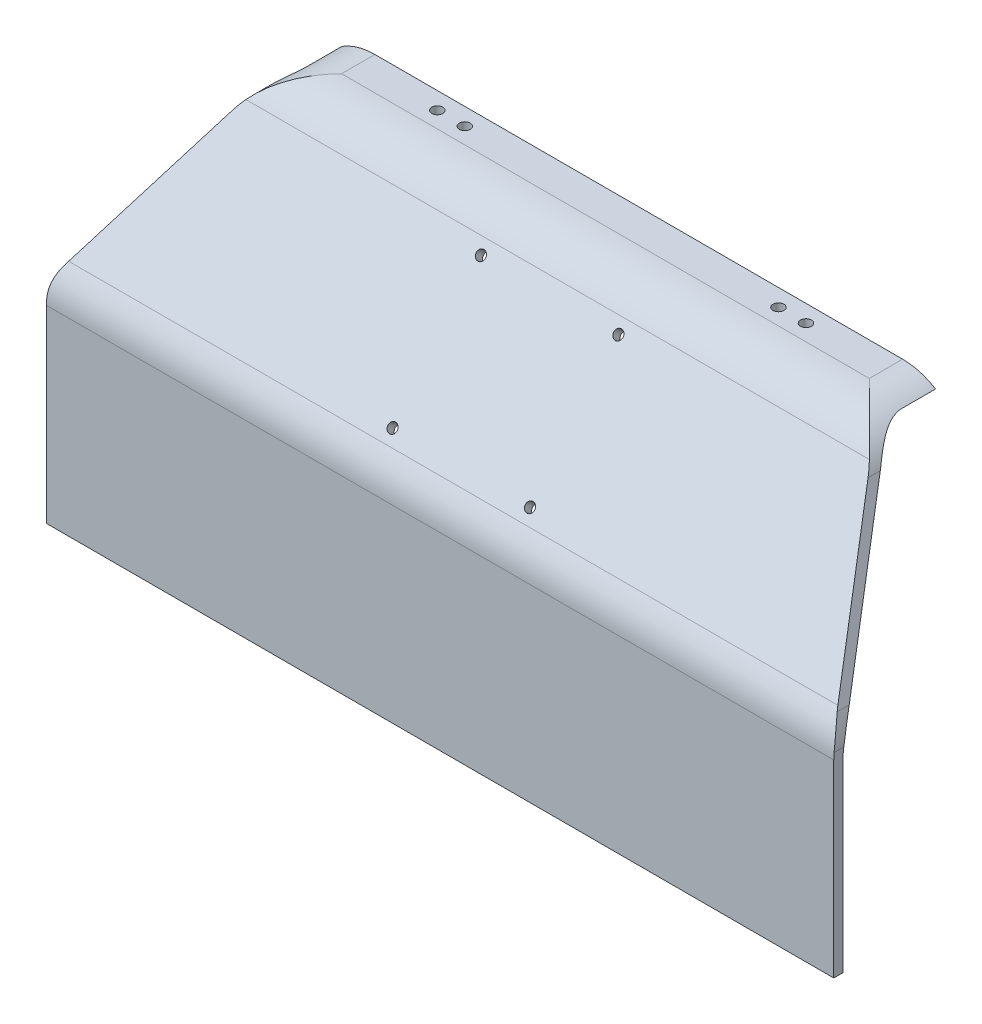
from build123d import *

# Parameters (mm, degrees)
SALIENTE_EXTRUIR1_DEPTH = 126
REDONDEO1_R             = 18
REDONDEO2_R             = 20
REDONDEO3_R             = 17
REDONDEO4_R             = 17
CORTAR_EXTRUIR1_DEPTH   = 186.234557368
REDONDEO5_R             = 17
CORTAR_EXTRUIR2_DEPTH   = 186.23455747
CROQUIS6_R              = 1.75
CORTAR_EXTRUIR3_DEPTH   = 20
CROQUIS7_W              = 252
CROQUIS7_H              = 3
CORTAR_EXTRUIR4_DEPTH   = 1
CROQUIS9_R              = 1.5
CORTAR_EXTRUIR5_DEPTH   = 183.297245602


with BuildPart() as part:
    # Croquis1 → Saliente-Extruir1 (new, symmetric)
    with BuildSketch(Plane(origin=(0, 0, 0), x_dir=(0, 0, -1), z_dir=(1, 0, 0))):
        Polygon((0, 0), (0, 66.908089297), (41.999818789, 116.961524227), (60.600895814, 116.961524227), (60.600895814, 119.961524227), (40.600895814, 119.961524227), (-3, 68), (-3, 0), align=None)
    extrude(amount=SALIENTE_EXTRUIR1_DEPTH, both=True)

    # Redondeo1
    redondeo1_edges = [part.edges().sort_by_distance(p)[0] for p in [
        (0, 68, 3),
    ]]
    fillet(redondeo1_edges, radius=REDONDEO1_R)

    # Redondeo2
    redondeo2_edges = [part.edges().sort_by_distance(p)[0] for p in [
        (0, 119.961524227, -40.600895814),
    ]]
    fillet(redondeo2_edges, radius=REDONDEO2_R)

    # Redondeo3
    redondeo3_edges = [part.edges().sort_by_distance(p)[0] for p in [
        (0, 116.961524227, -41.999818789),
    ]]
    fillet(redondeo3_edges, radius=REDONDEO3_R)

    # Redondeo4
    redondeo4_edges = [part.edges().sort_by_distance(p)[0] for p in [
        (0, 66.908089297, 0),
    ]]
    fillet(redondeo4_edges, radius=REDONDEO4_R)

    # Croquis2 → Cortar-Extruir1 (cut, through all)
    with BuildSketch(Plane.XY.offset(3)):
        Polygon((-96, 119.961524227), (-126, 68), (-126, 119.961524227), align=None)
    cortar_extruir1 = extrude(amount=-CORTAR_EXTRUIR1_DEPTH, mode=Mode.SUBTRACT)

    # Simetría1: Cortar-Extruir1 across plane
    add(cortar_extruir1.mirror(Plane(origin=(0, 0, 0), x_dir=(0, 0, 1), z_dir=(1, 0, 0))), mode=Mode.SUBTRACT)

    # Redondeo5
    # the kernel refuses this fillet: 17 mm, written as the material it takes off along each edge
    with BuildSketch(Plane(origin=(-126, 68, 13.153231119), x_dir=(0, -1, 0), z_dir=(0, 0, -1)), Plane(origin=(126, 68, 13.153231119), x_dir=(-0.49999999999999856, 0.8660254037844395, 0), z_dir=(0, 0, -1))) as redondeo5_piece_1:
        with BuildLine():
            CenterArc((REDONDEO5_R * 0.267949192431, -REDONDEO5_R), REDONDEO5_R, 90, 30)
            Line((-REDONDEO5_R * 0.232050807569, -REDONDEO5_R * 0.133974596216), (0, 0))
            Line((0, 0), (REDONDEO5_R * 0.267949192431, 0))
        make_face()
    extrude(amount=26.178446129, mode=Mode.SUBTRACT)

    # Croquis5 → Cortar-Extruir2 (cut, through all)
    with BuildSketch(Plane(origin=(0, 0, -60.600895814), x_dir=(-1, 0, 0), z_dir=(0, 0, -1))):
        with BuildLine():
            Line((84.452994616, 119.961524227), (96, 119.961524227))
            Line((96, 119.961524227), (101.773502692, 109.961524227))
            ThreePointArc((101.773502692, 109.961524227), (94.452994616, 117.282032303), (84.452994616, 119.961524227))
        make_face()
    cortar_extruir2 = extrude(amount=-CORTAR_EXTRUIR2_DEPTH, mode=Mode.SUBTRACT)

    # Simetría2: Cortar-Extruir2 across plane
    add(cortar_extruir2.mirror(Plane(origin=(0, 0, 0), x_dir=(0, 0, 1), z_dir=(1, 0, 0))), mode=Mode.SUBTRACT)

    # Croquis6 → Cortar-Extruir3 (cut)
    with BuildSketch(Plane(origin=(0, 119.961524227, 0), x_dir=(1, 0, 0), z_dir=(0, 1, 0))):
        with Locations(Location((-59, 55.100895814, 0), (0, 0, 270))):
            Circle(CROQUIS6_R)
        with Locations(Location((-50.2, 55.100895814, 0), (0, 0, 270))):
            Circle(CROQUIS6_R)
    cortar_extruir3 = extrude(amount=-CORTAR_EXTRUIR3_DEPTH, mode=Mode.SUBTRACT)

    # Simetría3: Cortar-Extruir3 across plane
    add(cortar_extruir3.mirror(Plane(origin=(0, 0, 0), x_dir=(0, 0, 1), z_dir=(1, 0, 0))), mode=Mode.SUBTRACT)

    # Croquis7 → Cortar-Extruir4 (cut)
    with BuildSketch(Plane.XZ):
        with Locations((0, 1.5)):
            Rectangle(CROQUIS7_W, CROQUIS7_H)
    extrude(amount=-CORTAR_EXTRUIR4_DEPTH, mode=Mode.SUBTRACT)

    # Croquis9 → Cortar-Extruir5 (cut, through all)
    with BuildSketch(Plane(origin=(0, 29.573173589, 35.243935869), x_dir=(1, 0, 0), z_dir=(0, 0.6427876096865381, 0.7660444431189791))):
        with Locations(Location((-22, 104.71412352, 0), (0, 0, 270))):
            Circle(CROQUIS9_R)
        with Locations(Location((22, 104.71412352, 0), (0, 0, 270))):
            Circle(CROQUIS9_R)
        with Locations(Location((22, 60.71412352, 0), (0, 0, 270))):
            Circle(CROQUIS9_R)
        with Locations(Location((-22, 60.71412352, 0), (0, 0, 270))):
            Circle(CROQUIS9_R)
    extrude(amount=-CORTAR_EXTRUIR5_DEPTH, mode=Mode.SUBTRACT)


solid = part.part
